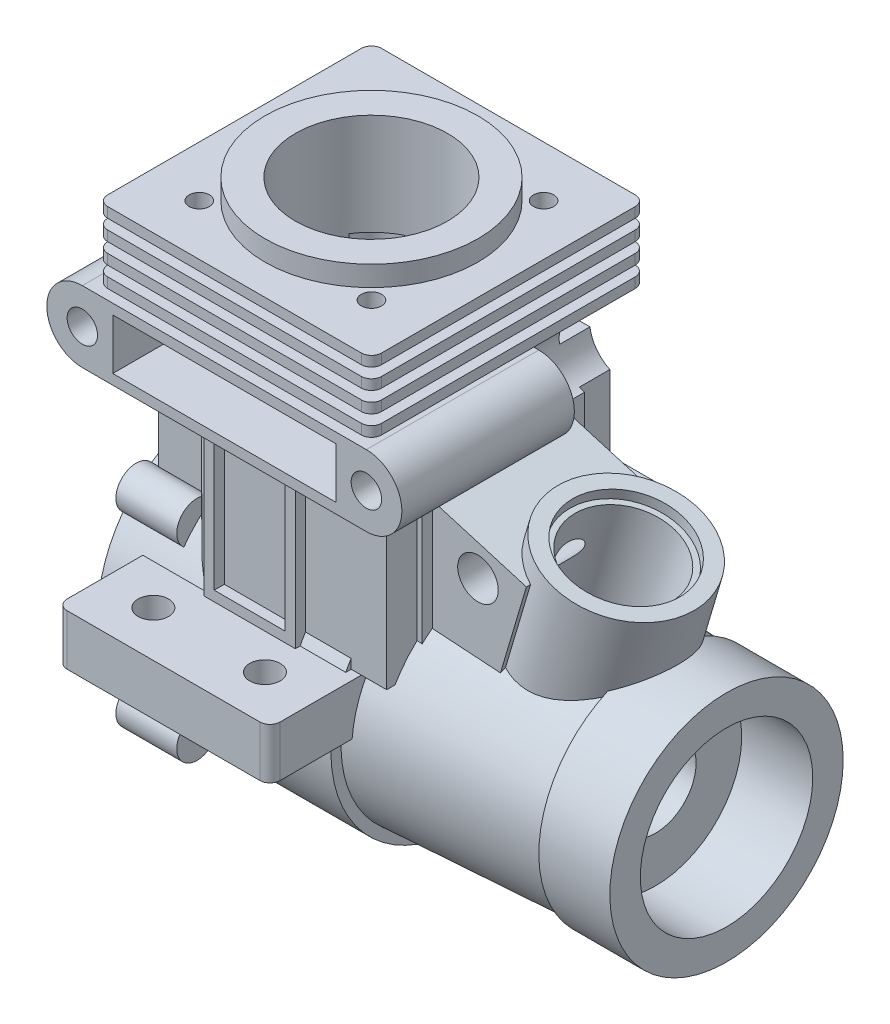
from build123d import *
from build123d.topology import SkipClean

# Parameters (mm, degrees)
SKETCH1_W                 = 27
SKETCH1_H                 = 27
BOSS_EXTRUDE2_DEPTH       = 1
SKETCH3_W                 = 23
SKETCH3_H                 = 23
BOSS_EXTRUDE3_DEPTH       = 1
SKETCH4_W                 = 27
SKETCH4_H                 = 27
BOSS_EXTRUDE4_DEPTH       = 1
SKETCH5_W                 = 23
SKETCH5_H                 = 23
BOSS_EXTRUDE5_DEPTH       = 1
SKETCH6_W                 = 27
SKETCH6_H                 = 27
BOSS_EXTRUDE6_DEPTH       = 1
SKETCH7_W                 = 23
SKETCH7_H                 = 23
BOSS_EXTRUDE7_DEPTH       = 1
SKETCH8_W                 = 27
SKETCH8_H                 = 27
BOSS_EXTRUDE8_DEPTH       = 1
FILLET1_R                 = 1
BOSS_EXTRUDE11_DEPTH      = 17
SKETCH12_R                = 1.5
CUT_EXTRUDE1_DEPTH        = 17
BOSS_EXTRUDE13_DEPTH      = 22
BOSS_EXTRUDE13_DEPTH_BACK = 7
SKETCH13_W                = 26
SKETCH13_H                = 16
CUT_EXTRUDE2_START        = -5.5
SKETCH16_R                = 3.5
CUT_EXTRUDE2_DEPTH        = 5.5
SKETCH21_W                = 19
SKETCH21_H                = 5.5
BOSS_EXTRUDE16_DEPTH      = 1
SKETCH22_W                = 19
SKETCH22_H                = 5.5
BOSS_EXTRUDE17_DEPTH      = 1
FILLET2_R                 = 1
SKETCH24_W                = 9
SKETCH24_H                = 19
BOSS_EXTRUDE18_DEPTH      = 4
SKETCH25_W                = 7
SKETCH25_H                = 17
CUT_EXTRUDE3_DEPTH        = 1
SKETCH26_R                = 1.5
CUT_EXTRUDE4_DEPTH        = 44.945989578
SKETCH27_W                = 9
SKETCH27_H                = 4
BOSS_EXTRUDE20_DEPTH      = 16
SKETCH29_W                = 7
SKETCH29_H                = 14
CUT_EXTRUDE6_DEPTH        = 1
BOSS_EXTRUDE22_DEPTH      = 19
BOSS_EXTRUDE23_DEPTH      = 16
SKETCH33_W                = 8
SKETCH33_H                = 3
BOSS_EXTRUDE24_DEPTH      = 16
SKETCH34_W                = 8
SKETCH34_H                = 3
BOSS_EXTRUDE25_DEPTH      = 19
SKETCH35_R                = 3.5
CUT_EXTRUDE7_DEPTH        = 19
BOSS_EXTRUDE27_DEPTH      = 1
BOSS_EXTRUDE27_DEPTH_BACK = 22
SKETCH37_R                = 13
SKETCH38_R                = 12
BOSS_EXTRUDE29_DEPTH      = 19
BOSS_EXTRUDE29_TAPER      = 3
SKETCH47_R                = 11.5
BOSS_EXTRUDE31_DEPTH      = 7
BOSS_EXTRUDE33_DEPTH      = 7
BOSS_EXTRUDE33_DEPTH_BACK = 7
SKETCH52_R                = 2
BOSS_EXTRUDE34_DEPTH      = 6
SKETCH53_R                = 10.5
BOSS_EXTRUDE35_DEPTH      = 2
SKETCH55_R                = 4
CUT_EXTRUDE13_DEPTH       = 69.778630463
SKETCH57_R                = 8.5
CUT_EXTRUDE14_DEPTH       = 7
SKETCH58_R                = 10.5
CUT_EXTRUDE15_DEPTH       = 20
SKETCH59_R                = 11
CUT_EXTRUDE16_DEPTH       = 15
SKETCH60_R                = 11
BOSS_EXTRUDE36_DEPTH      = 9
SKETCH61_R                = 10.5
CUT_EXTRUDE17_DEPTH       = 9
CUT_EXTRUDE18_START       = -7
SKETCH62_R                = 8.5
CUT_EXTRUDE18_DEPTH       = 7
SKETCH63_R                = 5
CUT_EXTRUDE19_DEPTH       = 20
CUT_EXTRUDE19_DRAFT       = -3
SKETCH54_R                = 7.5
CUT_EXTRUDE20_DEPTH       = 40
SKETCH64_W                = 9
SKETCH64_H                = 5
CUT_EXTRUDE21_DEPTH       = 5
SKETCH65_W                = 13
SKETCH65_H                = 5
CUT_EXTRUDE22_DEPTH       = 13
SKETCH66_R                = 2
CUT_EXTRUDE23_DEPTH       = 35
BOSS_EXTRUDE37_DEPTH      = 27
SKETCH68_R                = 2
CUT_EXTRUDE24_DEPTH       = 15
BOSS_EXTRUDE38_DEPTH      = 10
SKETCH70_R                = 5.5
CUT_EXTRUDE25_DEPTH       = 1
SKETCH71_R                = 1
CUT_EXTRUDE26_DEPTH       = 4
SKETCH72_R                = 2
CUT_EXTRUDE27_DEPTH       = 59.388783301
SKETCH73_R                = 1
CUT_EXTRUDE28_DEPTH       = 8
BOSS_EXTRUDE39_DEPTH      = 12
BOSS_EXTRUDE39_DEPTH_BACK = 28
SKETCH74_W                = 21
SKETCH74_H                = 5
FILLET6_R                 = 1
SKETCH75_R                = 10.5
CUT_EXTRUDE30_DEPTH       = 24
BOSS_EXTRUDE40_START      = 2
SKETCH76_R                = 10.5
SKETCH76_R_2              = 8.5
BOSS_EXTRUDE40_DEPTH      = 2
SKETCH77_R                = 11
CUT_EXTRUDE32_DEPTH       = 15
SKETCH78_R                = 11
SKETCH78_R_2              = 10.5
BOSS_EXTRUDE41_DEPTH      = 9
SKETCH79_R                = 1.5
CUT_EXTRUDE33_DEPTH       = 5


with BuildPart() as part:
    # Sketch1 → Boss-Extrude2 (new body)
    with BuildSketch(Plane(origin=(0, 0, 0), x_dir=(1, 0, 0), z_dir=(0, 1, 0))):
        Rectangle(SKETCH1_W, SKETCH1_H)
    extrude(amount=BOSS_EXTRUDE2_DEPTH)

    # Sketch3 → Boss-Extrude3 (add)
    with BuildSketch(Plane(origin=(0, 1, 0), x_dir=(1, 0, 0), z_dir=(0, 1, 0))):
        Rectangle(SKETCH3_W, SKETCH3_H)
    extrude(amount=BOSS_EXTRUDE3_DEPTH)

    # Sketch4 → Boss-Extrude4 (add)
    with BuildSketch(Plane(origin=(0, 2, 0), x_dir=(1, 0, 0), z_dir=(0, 1, 0))):
        Rectangle(SKETCH4_W, SKETCH4_H)
    extrude(amount=BOSS_EXTRUDE4_DEPTH)

    # Sketch5 → Boss-Extrude5 (add)
    with BuildSketch(Plane(origin=(0, 3, 0), x_dir=(1, 0, 0), z_dir=(0, 1, 0))):
        Rectangle(SKETCH5_W, SKETCH5_H)
    extrude(amount=BOSS_EXTRUDE5_DEPTH)

    # Sketch6 → Boss-Extrude6 (add)
    with BuildSketch(Plane(origin=(0, 4, 0), x_dir=(1, 0, 0), z_dir=(0, 1, 0))):
        Rectangle(SKETCH6_W, SKETCH6_H)
    extrude(amount=BOSS_EXTRUDE6_DEPTH)

    # Sketch7 → Boss-Extrude7 (add)
    with BuildSketch(Plane(origin=(0, 5, 0), x_dir=(1, 0, 0), z_dir=(0, 1, 0))):
        Rectangle(SKETCH7_W, SKETCH7_H)
    extrude(amount=BOSS_EXTRUDE7_DEPTH)

    # Sketch8 → Boss-Extrude8 (add)
    with BuildSketch(Plane(origin=(0, 6, 0), x_dir=(1, 0, 0), z_dir=(0, 1, 0))):
        Rectangle(SKETCH8_W, SKETCH8_H)
    extrude(amount=BOSS_EXTRUDE8_DEPTH)

    # Fillet1
    fillet1_edges = [part.edges().sort_by_distance(p)[0] for p in [
        (-13.5, 0.5, 13.5),
        (-11.5, 1.5, 11.5),
        (-13.5, 2.5, 13.5),
        (-11.5, 3.5, 11.5),
        (-13.5, 4.5, 13.5),
        (-11.5, 5.5, 11.5),
        (-13.5, 6.5, 13.5),
        (13.5, 0.5, 13.5),
        (11.5, 1.5, 11.5),
        (13.5, 2.5, 13.5),
        (11.5, 3.5, 11.5),
        (13.5, 4.5, 13.5),
        (11.5, 5.5, 11.5),
        (13.5, 6.5, 13.5),
        (13.5, 0.5, -13.5),
        (11.5, 1.5, -11.5),
        (13.5, 2.5, -13.5),
        (11.5, 3.5, -11.5),
        (13.5, 4.5, -13.5),
        (11.5, 5.5, -11.5),
        (13.5, 6.5, -13.5),
        (-13.5, 0.5, -13.5),
        (-11.5, 1.5, -11.5),
        (-13.5, 2.5, -13.5),
        (-11.5, 3.5, -11.5),
        (-13.5, 4.5, -13.5),
        (-11.5, 5.5, -11.5),
        (-13.5, 6.5, -13.5),
    ]]
    fillet(fillet1_edges, radius=FILLET1_R)

    # Sketch10 → Boss-Extrude11 (add)
    with BuildSketch(Plane.XY.offset(14.5)):
        with BuildLine():
            Line((-14, 0), (14, 0))
            ThreePointArc((14, 0), (17.5, -3.5), (14, -7))
            Line((14, -7), (-14, -7))
            ThreePointArc((-14, -7), (-17.5, -3.5), (-14, 0))
        make_face()
    extrude(amount=-BOSS_EXTRUDE11_DEPTH)

    # Sketch12 → Cut-Extrude1 (cut)
    with BuildSketch(Plane.XY.offset(14.5)):
        with Locations((-14, -3.5)):
            Circle(SKETCH12_R)
        with Locations((14, -3.5)):
            Circle(SKETCH12_R)
    extrude(amount=-CUT_EXTRUDE1_DEPTH, mode=Mode.SUBTRACT)

    # Sketch13 → Boss-Extrude13 (add, two sides: drawn at the far end of the back side and taken through both)
    with BuildSketch(Plane(origin=(0, -7, 0), x_dir=(-1, 0, 0), z_dir=(0, -1, 0)).offset(-BOSS_EXTRUDE13_DEPTH_BACK)):
        Rectangle(SKETCH13_W, SKETCH13_H)
    extrude(amount=BOSS_EXTRUDE13_DEPTH + BOSS_EXTRUDE13_DEPTH_BACK)

    # Sketch16 → Cut-Extrude2 (cut)
    with BuildSketch(Plane(origin=(0, 0, -8), x_dir=(-1, 0, 0), z_dir=(0, 0, -1)).offset(CUT_EXTRUDE2_START)):
        with Locations((-14, -3.5)):
            Circle(SKETCH16_R)
        with Locations((14, -3.5)):
            Circle(SKETCH16_R)
    extrude(amount=CUT_EXTRUDE2_DEPTH, mode=Mode.SUBTRACT)

    # Sketch21 → Boss-Extrude16 (add)
    with BuildSketch(Plane(origin=(0, -1, 0), x_dir=(-1, 0, 0), z_dir=(0, -1, 0))):
        with Locations((0, 10.75)):
            Rectangle(SKETCH21_W, SKETCH21_H)
    extrude(amount=BOSS_EXTRUDE16_DEPTH)

    # Sketch22 → Boss-Extrude17 (add)
    with BuildSketch(Plane(origin=(0, -3, 0), x_dir=(-1, 0, 0), z_dir=(0, -1, 0))):
        with Locations((0, 10.75)):
            Rectangle(SKETCH22_W, SKETCH22_H)
    extrude(amount=BOSS_EXTRUDE17_DEPTH)

    # Fillet2
    fillet2_edges = [part.edges().sort_by_distance(p)[0] for p in [
        (9.5, -3.5, -13.5),
        (9.5, -1.5, -13.5),
        (-9.5, -1.5, -13.5),
        (-9.5, -3.5, -13.5),
    ]]
    fillet(fillet2_edges, radius=FILLET2_R)

    # Sketch24 → Boss-Extrude18 (add)
    with BuildSketch(Plane(origin=(0, 0, -8), x_dir=(-1, 0, 0), z_dir=(0, 0, -1))):
        with Locations((0, -13.5)):
            Rectangle(SKETCH24_W, SKETCH24_H)
    extrude(amount=BOSS_EXTRUDE18_DEPTH)

    # Sketch25 → Cut-Extrude3 (cut)
    with BuildSketch(Plane(origin=(0, 0, -12), x_dir=(-1, 0, 0), z_dir=(0, 0, -1))):
        with Locations((0, -13.5)):
            Rectangle(SKETCH25_W, SKETCH25_H)
    extrude(amount=-CUT_EXTRUDE3_DEPTH, mode=Mode.SUBTRACT)

    # Sketch26 → Cut-Extrude4 (cut, through all)
    with BuildSketch(Plane.XY.offset(14.5)):
        with Locations((-14, -3.5)):
            Circle(SKETCH26_R)
        with Locations((14, -3.5)):
            Circle(SKETCH26_R)
    extrude(amount=-CUT_EXTRUDE4_DEPTH, mode=Mode.SUBTRACT)

    # Sketch27 → Boss-Extrude20 (add)
    with BuildSketch(Plane.XZ.offset(7)):
        with Locations((0, 10)):
            Rectangle(SKETCH27_W, SKETCH27_H)
    extrude(amount=BOSS_EXTRUDE20_DEPTH)

    # Sketch29 → Cut-Extrude6 (cut)
    with BuildSketch(Plane.XY.offset(12)):
        with Locations((0, -15)):
            Rectangle(SKETCH29_W, SKETCH29_H)
    extrude(amount=-CUT_EXTRUDE6_DEPTH, mode=Mode.SUBTRACT)

    # Sketch30 → Boss-Extrude22 (add)
    with BuildSketch(Plane(origin=(0, -4, 0), x_dir=(-1, 0, 0), z_dir=(0, -1, 0))):
        with BuildLine():
            Line((4.5, 8), (8.140816141, 8))
            ThreePointArc((8.140816141, 8), (6.621320344, 10.121320344), (4.5, 11.640816141))
            Line((4.5, 11.640816141), (4.5, 8))
        make_face()
    extrude(amount=BOSS_EXTRUDE22_DEPTH)

    # Sketch32 → Boss-Extrude23 (add)
    with BuildSketch(Plane.XZ.offset(7)):
        with BuildLine():
            Line((-8.140816141, 8), (-4.5, 8))
            Line((-4.5, 8), (-4.5, 11.640816141))
            ThreePointArc((-4.5, 11.640816141), (-6.621320344, 10.121320344), (-8.140816141, 8))
        make_face()
    extrude(amount=BOSS_EXTRUDE23_DEPTH)

    # Sketch33 → Boss-Extrude24 (add)
    with BuildSketch(Plane.XZ.offset(7)):
        with Locations((8.5, 9.5)):
            Rectangle(SKETCH33_W, SKETCH33_H)
    extrude(amount=BOSS_EXTRUDE24_DEPTH)

    # Sketch34 → Boss-Extrude25 (add)
    with BuildSketch(Plane.XZ.offset(4)):
        with Locations((8.5, -9.5)):
            Rectangle(SKETCH34_W, SKETCH34_H)
    extrude(amount=BOSS_EXTRUDE25_DEPTH)

    # Sketch35 → Cut-Extrude7 (cut)
    with BuildSketch(Plane(origin=(0, 0, -2.5), x_dir=(-1, 0, 0), z_dir=(0, 0, -1))):
        with Locations((-14, -3.5)):
            Circle(SKETCH35_R)
    extrude(amount=CUT_EXTRUDE7_DEPTH, mode=Mode.SUBTRACT)

    # Sketch37 → Boss-Extrude27 (add, two sides: drawn at the far end of the back side and taken through both)
    with BuildSketch(Plane.ZY.offset(13).offset(-BOSS_EXTRUDE27_DEPTH_BACK)):
        with Locations((0, -29)):
            Circle(SKETCH37_R)
    extrude(amount=BOSS_EXTRUDE27_DEPTH + BOSS_EXTRUDE27_DEPTH_BACK)

    # Sketch38 → Boss-Extrude29 (add)
    with BuildSketch(Plane(origin=(9, 0, 0), x_dir=(0, 0, -1), z_dir=(1, 0, 0))):
        with Locations((0, -29)):
            Circle(SKETCH38_R)
    extrude(amount=BOSS_EXTRUDE29_DEPTH, taper=BOSS_EXTRUDE29_TAPER)

    # Sketch47 → Boss-Extrude31 (add)
    with BuildSketch(Plane(origin=(28, 0, 0), x_dir=(0, 0, -1), z_dir=(1, 0, 0))):
        with Locations((0, -29)):
            Circle(SKETCH47_R)
    extrude(amount=BOSS_EXTRUDE31_DEPTH)

    # Sketch49 → Revolve3 (revolve)
    with BuildSketch(Plane.XY):
        Polygon((20.273349622, -26.386782986), (25.104834149, -10.087802734), (31.816178959, -12.077237539), (26.984694432, -28.376217792), align=None)
    revolve(axis=Axis((20.273349622, -26.386782986, 0), (0.28420497219112495, 0.9587635442494891, 0)))

    # Sketch51 → Boss-Extrude33 (add, two sides: drawn at the far end of the back side and taken through both)
    with BuildSketch(Plane.XY.offset(-BOSS_EXTRUDE33_DEPTH_BACK)):
        Polygon((9.701140264, -7.6077268), (4.72260902, -24.402768154), (17.293497056, -28.129139381), (22.272028301, -11.334098027), align=None)
    extrude(amount=BOSS_EXTRUDE33_DEPTH + BOSS_EXTRUDE33_DEPTH_BACK)

    # Sketch52 → Boss-Extrude34 (add)
    with BuildSketch(Plane.ZY.offset(14)):
        with Locations((-9.192388155, -19.807611845)):
            Circle(SKETCH52_R)
        with Locations((-9.192388155, -38.192388155)):
            Circle(SKETCH52_R)
        with Locations((9.192388155, -38.192388155)):
            Circle(SKETCH52_R)
        with Locations((9.192388155, -19.807611845)):
            Circle(SKETCH52_R)
    extrude(amount=-BOSS_EXTRUDE34_DEPTH)

    # Sketch53 → Boss-Extrude35 (add)
    with BuildSketch(Plane(origin=(0, 7, 0), x_dir=(1, 0, 0), z_dir=(0, 1, 0))):
        Circle(SKETCH53_R)
    extrude(amount=BOSS_EXTRUDE35_DEPTH)

    # Sketch55 → Cut-Extrude13 (cut, through all)
    with BuildSketch(Plane(origin=(35, 0, 0), x_dir=(0, 0, -1), z_dir=(1, 0, 0))):
        with Locations((0, -29)):
            Circle(SKETCH55_R)
    extrude(amount=-CUT_EXTRUDE13_DEPTH, mode=Mode.SUBTRACT)

    # Sketch57 → Cut-Extrude14 (cut)
    with BuildSketch(Plane(origin=(35, 0, 0), x_dir=(0, 0, -1), z_dir=(1, 0, 0))):
        with Locations((0, -29)):
            Circle(SKETCH57_R)
    extrude(amount=-CUT_EXTRUDE14_DEPTH, mode=Mode.SUBTRACT)

    # Sketch58 → Cut-Extrude15 (cut)
    with BuildSketch(Plane.ZY.offset(14)):
        with Locations((0, -29)):
            Circle(SKETCH58_R)
    extrude(amount=-CUT_EXTRUDE15_DEPTH, mode=Mode.SUBTRACT)

    # Sketch59 → Cut-Extrude16 (cut)
    with BuildSketch(Plane.ZY.offset(14)):
        with Locations((0, -29)):
            Circle(SKETCH59_R)
    extrude(amount=-CUT_EXTRUDE16_DEPTH, mode=Mode.SUBTRACT)

    # Sketch60 → Boss-Extrude36 (add)
    with BuildSketch(Plane.ZY.offset(14)):
        with Locations((0, -29)):
            Circle(SKETCH60_R)
    extrude(amount=-BOSS_EXTRUDE36_DEPTH)

    # Sketch61 → Cut-Extrude17 (cut)
    with BuildSketch(Plane.ZY.offset(14)):
        with Locations((0, -29)):
            Circle(SKETCH61_R)
    extrude(amount=-CUT_EXTRUDE17_DEPTH, mode=Mode.SUBTRACT)

    # Sketch62 → Cut-Extrude18 (cut)
    with BuildSketch(Plane.ZY.offset(-6).offset(CUT_EXTRUDE18_START)):
        with Locations((0, -29)):
            Circle(SKETCH62_R)
    extrude(amount=CUT_EXTRUDE18_DEPTH, mode=Mode.SUBTRACT)


with BuildPart() as cut_extrude19_tool:
    # Sketch63 → Cut-Extrude19 (with draft: the straight prism first)
    with BuildSketch(Plane(origin=(-0.720999256, -2.432286096, 0), x_dir=(0.9587635442494891, -0.284204972191125, 0), z_dir=(0.284204972191125, 0.9587635442494891, 0))):
        with Locations((26.936603462, 0)):
            Circle(SKETCH63_R)
    extrude(amount=-CUT_EXTRUDE19_DEPTH)
    # Cut-Extrude19: the draft: its side faces are tilted about the plane it starts from
    cut_extrude19_sides = [cut_extrude19_tool.faces().sort_by_distance(p)[0] for p in [
        (17.468966706, -18.254413316, 0),
    ]]
    draft(cut_extrude19_sides, Plane(origin=(-0.720999256, -2.432286096, 0), x_dir=(0.9587635442494891, -0.284204972191125, 0), z_dir=(0.284204972191125, 0.9587635442494891, 0)), CUT_EXTRUDE19_DRAFT)


with BuildPart() as part_1:
    add(part.part)

    # Cut-Extrude19: cut by cut_extrude19_tool
    add(cut_extrude19_tool.part, mode=Mode.SUBTRACT)

    # Sketch54 → Cut-Extrude20 (cut)
    with BuildSketch(Plane(origin=(0, 9, 0), x_dir=(1, 0, 0), z_dir=(0, 1, 0))):
        Circle(SKETCH54_R)
    extrude(amount=-CUT_EXTRUDE20_DEPTH, mode=Mode.SUBTRACT)

    # Sketch64 → Cut-Extrude21 (cut)
    with BuildSketch(Plane.XY.offset(14.5)):
        with Locations((6.5, -3.5)):
            Rectangle(SKETCH64_W, SKETCH64_H)
    extrude(amount=-CUT_EXTRUDE21_DEPTH, mode=Mode.SUBTRACT)

    # Sketch65 → Cut-Extrude22 (cut)
    with BuildSketch(Plane.XY.offset(14.5)):
        with Locations((-4.5, -3.5)):
            Rectangle(SKETCH65_W, SKETCH65_H)
    extrude(amount=-CUT_EXTRUDE22_DEPTH, mode=Mode.SUBTRACT)

    # Sketch66 → Cut-Extrude23 (cut)
    with BuildSketch(Plane(origin=(0, 9, 0), x_dir=(1, 0, 0), z_dir=(0, 1, 0))):
        with Locations((-5, 5.590169944)):
            Circle(SKETCH66_R)
        with Locations((5, 5.590169944)):
            Circle(SKETCH66_R)
        with Locations((5, -5.590169944)):
            Circle(SKETCH66_R)
    extrude(amount=-CUT_EXTRUDE23_DEPTH, mode=Mode.SUBTRACT)

    # Sketch67 → Boss-Extrude37 (add)
    with SkipClean():  # the faces are left unmerged after this step: merging them gives an invalid solid
        with BuildSketch(Plane(origin=(0, 9, 0), x_dir=(1, 0, 0), z_dir=(0, 1, 0))):
            with BuildLine():
                ThreePointArc((-6.645686612, 4.453633286), (-6.485096336, 4.250584608), (-6.299624012, 4.069980013))
                ThreePointArc((-6.299624012, 4.069980013), (-5, 5.590169944), (-3.344820432, 6.712836679))
                ThreePointArc((-3.344820432, 6.712836679), (-3.503698686, 6.917227733), (-3.687646721, 7.099384597))
                ThreePointArc((-3.687646721, 7.099384597), (-5.333333333, 5.96284794), (-6.645686612, 4.453633286))
            make_face()
            with BuildLine():
                ThreePointArc((3.772854672, 7.169446469), (3.540865898, 6.957988526), (3.344820432, 6.712836679))
                ThreePointArc((3.344820432, 6.712836679), (5, 5.590169944), (6.299624012, 4.069980013))
                ThreePointArc((6.299624012, 4.069980013), (6.498483779, 4.265577039), (6.668196761, 4.486938524))
                ThreePointArc((6.668196761, 4.486938524), (5.38855777, 6.009556461), (3.772854672, 7.169446469))
            make_face()
            with BuildLine():
                ThreePointArc((6.645686612, -4.453633286), (6.485096336, -4.250584608), (6.299624012, -4.069980013))
                ThreePointArc((6.299624012, -4.069980013), (5, -5.590169944), (3.344820432, -6.712836679))
                ThreePointArc((3.344820432, -6.712836679), (3.503698686, -6.917227733), (3.687646721, -7.099384597))
                ThreePointArc((3.687646721, -7.099384597), (5.333333333, -5.96284794), (6.645686612, -4.453633286))
            make_face()
        extrude(amount=-BOSS_EXTRUDE37_DEPTH)

    # Sketch68 → Cut-Extrude24 (cut)
    with SkipClean():  # the faces are left unmerged after this step: merging them gives an invalid solid
        with BuildSketch(Plane(origin=(0, 9, 0), x_dir=(1, 0, 0), z_dir=(0, 1, 0))):
            with Locations((-5, 5.590169944)):
                Circle(SKETCH68_R)
            with Locations((5, 5.590169944)):
                Circle(SKETCH68_R)
            with Locations((5, -5.590169944)):
                Circle(SKETCH68_R)
        extrude(amount=-CUT_EXTRUDE24_DEPTH, mode=Mode.SUBTRACT)

    # Sketch69 → Boss-Extrude38 (add)
    with SkipClean():  # the faces are left unmerged after this step: merging them gives an invalid solid
        with BuildSketch(Plane(origin=(0, 9, 0), x_dir=(1, 0, 0), z_dir=(0, 1, 0))):
            with BuildLine():
                ThreePointArc((-3.344820432, 6.712836679), (-6.333333333, 7.080881929), (-6.299624012, 4.069980013))
                ThreePointArc((-6.299624012, 4.069980013), (-5, 5.590169944), (-3.344820432, 6.712836679))
            make_face()
            with BuildLine():
                ThreePointArc((6.299624012, 4.069980013), (6.333333333, 7.080881929), (3.344820432, 6.712836679))
                ThreePointArc((3.344820432, 6.712836679), (5, 5.590169944), (6.299624012, 4.069980013))
            make_face()
            with BuildLine():
                ThreePointArc((3.344820432, -6.712836679), (6.333333333, -7.080881929), (6.299624012, -4.069980013))
                ThreePointArc((6.299624012, -4.069980013), (5, -5.590169944), (3.344820432, -6.712836679))
            make_face()
        extrude(amount=-BOSS_EXTRUDE38_DEPTH)

    # Sketch70 → Cut-Extrude25 (cut)
    with SkipClean():  # the faces are left unmerged after this step: merging them gives an invalid solid
        with BuildSketch(Plane(origin=(-0.720999256, -2.432286096, 0), x_dir=(0.9587635442494891, -0.284204972191125, 0), z_dir=(0.284204972191125, 0.9587635442494891, 0))):
            with Locations((26.936603462, 0)):
                Circle(SKETCH70_R)
        extrude(amount=-CUT_EXTRUDE25_DEPTH, mode=Mode.SUBTRACT)

    # Sketch71 → Cut-Extrude26 (cut)
    with SkipClean():  # the faces are left unmerged after this step: merging them gives an invalid solid
        with BuildSketch(Plane.ZY.offset(14)):
            with Locations((-9.192388155, -19.807611845)):
                Circle(SKETCH71_R)
            with Locations((9.192388155, -19.807611845)):
                Circle(SKETCH71_R)
            with Locations((9.192388155, -38.192388155)):
                Circle(SKETCH71_R)
            with Locations((-9.192388155, -38.192388155)):
                Circle(SKETCH71_R)
        extrude(amount=-CUT_EXTRUDE26_DEPTH, mode=Mode.SUBTRACT)

    # Sketch72 → Cut-Extrude27 (cut, through all)
    with SkipClean():  # the faces are left unmerged after this step: merging them gives an invalid solid
        with BuildSketch(Plane.XY.offset(7)):
            with Locations((17.5, -13)):
                Circle(SKETCH72_R)
        extrude(amount=-CUT_EXTRUDE27_DEPTH, mode=Mode.SUBTRACT)

    # Sketch73 → Cut-Extrude28 (cut)
    with SkipClean():  # the faces are left unmerged after this step: merging them gives an invalid solid
        with BuildSketch(Plane(origin=(0, 9, 0), x_dir=(1, 0, 0), z_dir=(0, 1, 0))):
            with Locations((-8.485281374, 8.485281374)):
                Circle(SKETCH73_R)
            with Locations((8.485281374, 8.485281374)):
                Circle(SKETCH73_R)
            with Locations((8.485281374, -8.485281374)):
                Circle(SKETCH73_R)
            with Locations((-8.485281374, -8.485281374)):
                Circle(SKETCH73_R)
        extrude(amount=-CUT_EXTRUDE28_DEPTH, mode=Mode.SUBTRACT)

    # Sketch74 → Boss-Extrude39 (add, two sides: drawn at the far end of the back side and taken through both)
    with SkipClean():  # the faces are left unmerged after this step: merging them gives an invalid solid
        with BuildSketch(Plane(origin=(0, 0, -8), x_dir=(-1, 0, 0), z_dir=(0, 0, -1)).offset(-BOSS_EXTRUDE39_DEPTH_BACK)):
            with Locations((0.5, -25.5)):
                Rectangle(SKETCH74_W, SKETCH74_H)
        extrude(amount=BOSS_EXTRUDE39_DEPTH + BOSS_EXTRUDE39_DEPTH_BACK)

    # Fillet6
    fillet6_edges = [part_1.edges().sort_by_distance(p)[0] for p in [
        (-11, -25.5, 20),
        (10, -25.5, 20),
        (-11, -25.5, -20),
        (10, -25.5, -20),
    ]]
    fillet(fillet6_edges, radius=FILLET6_R)

    # Sketch75 → Cut-Extrude30 (cut)
    with SkipClean():  # the faces are left unmerged after this step: merging them gives an invalid solid
        with BuildSketch(Plane.ZY.offset(14)):
            with Locations((0, -29)):
                Circle(SKETCH75_R)
        extrude(amount=-CUT_EXTRUDE30_DEPTH, mode=Mode.SUBTRACT)

    # Sketch76 → Boss-Extrude40 (add)
    with SkipClean():  # the faces are left unmerged after this step: merging them gives an invalid solid
        with BuildSketch(Plane.ZY.offset(-10).offset(BOSS_EXTRUDE40_START)):
            with Locations((0, -29)):
                Circle(SKETCH76_R)
            with Locations((0, -29)):
                Circle(SKETCH76_R_2, mode=Mode.SUBTRACT)
        extrude(amount=-BOSS_EXTRUDE40_DEPTH)

    # Sketch77 → Cut-Extrude32 (cut)
    with SkipClean():  # the faces are left unmerged after this step: merging them gives an invalid solid
        with BuildSketch(Plane.ZY.offset(14)):
            with Locations((0, -29)):
                Circle(SKETCH77_R)
        extrude(amount=-CUT_EXTRUDE32_DEPTH, mode=Mode.SUBTRACT)

    # Sketch78 → Boss-Extrude41 (add)
    with SkipClean():  # the faces are left unmerged after this step: merging them gives an invalid solid
        with BuildSketch(Plane.ZY.offset(14)):
            with Locations((0, -29)):
                Circle(SKETCH78_R)
            with Locations((0, -29)):
                Circle(SKETCH78_R_2, mode=Mode.SUBTRACT)
        extrude(amount=-BOSS_EXTRUDE41_DEPTH)

    # Sketch79 → Cut-Extrude33 (cut)
    with SkipClean():  # the faces are left unmerged after this step: merging them gives an invalid solid
        with BuildSketch(Plane(origin=(0, -23, 0), x_dir=(1, 0, 0), z_dir=(0, 1, 0))):
            with Locations((-6, 15.5)):
                Circle(SKETCH79_R)
            with Locations((5, 15.5)):
                Circle(SKETCH79_R)
            with Locations((5, -15.5)):
                Circle(SKETCH79_R)
            with Locations((-6, -15.5)):
                Circle(SKETCH79_R)
        extrude(amount=-CUT_EXTRUDE33_DEPTH, mode=Mode.SUBTRACT)


solid = part_1.part
